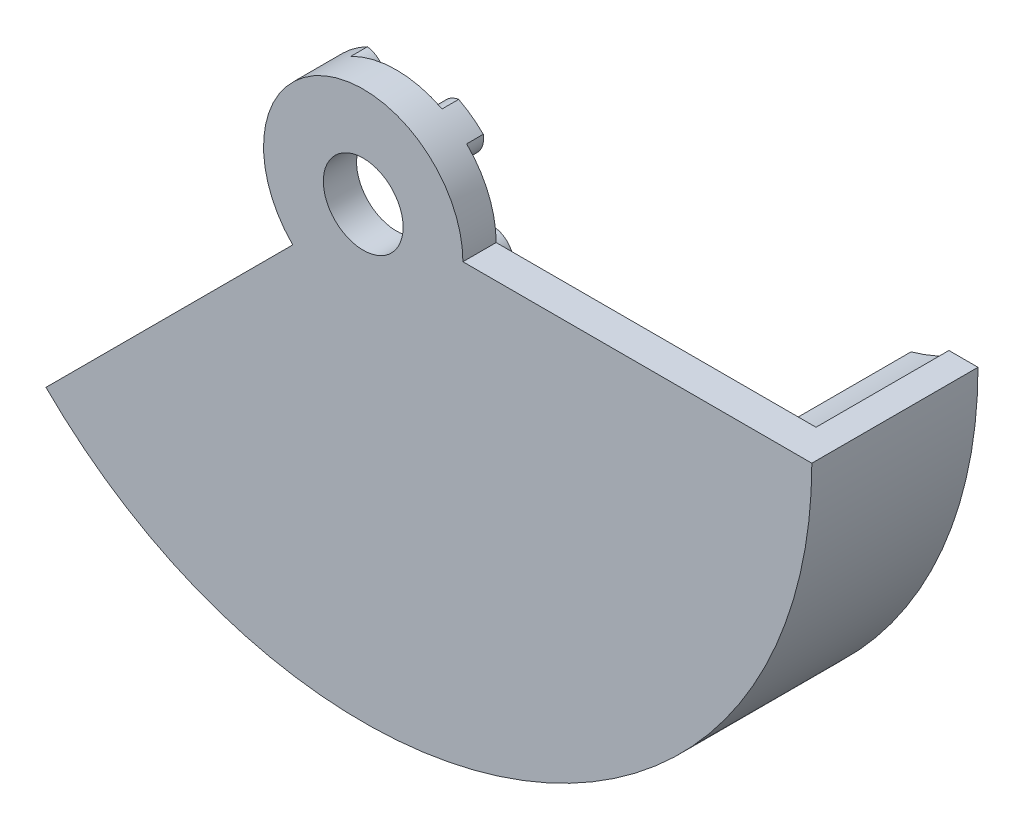
from build123d import *

# Parameters (mm, degrees)
SKETCH4_R           = 67.5
BOSS_EXTRUDE1_DEPTH = 50
CUT_EXTRUDE2_DEPTH  = 250
BOSS_EXTRUDE2_DEPTH = 5
SKETCH7_R           = 6
CUT_EXTRUDE3_DEPTH  = 5
SKETCH8_R           = 10
SKETCH8_R_2         = 6
BOSS_EXTRUDE3_DEPTH = 5
CUT_EXTRUDE5_DEPTH  = 30
BOSS_EXTRUDE4_START = -5
SKETCH11_R          = 15
SKETCH11_R_2        = 6
BOSS_EXTRUDE4_DEPTH = 5
BOSS_EXTRUDE5_DEPTH = 2.5


with BuildPart() as part:
    # Sketch4 → Boss-Extrude1 (new body)
    with BuildSketch(Plane.XY):
        Circle(SKETCH4_R)
        with BuildLine():
            ThreePointArc((11.932101608, 56.248332875), (11.217693516, 56.395153623), (10.501480633, 56.53290108))
            ThreePointArc((10.501480633, 56.53290108), (9.892570679, 59.547679882), (8.978186327, 62.484270391))
            ThreePointArc((8.978186327, 62.484270391), (8.23959641, 62.585948319), (7.49985715, 62.678896119))
            ThreePointArc((7.49985715, 62.678896119), (5.856584138, 60.079027591), (4.488140116, 57.324572378))
            ThreePointArc((4.488140116, 57.324572378), (3.760679931, 57.376888086), (3.032614698, 57.419972554))
            ThreePointArc((3.032614698, 57.419972554), (2.035406455, 60.329480808), (0.74554281, 63.12159727))
            ThreePointArc((0.74554281, 63.12159727), (0, 63.126), (-0.74554281, 63.12159727))
            ThreePointArc((-0.74554281, 63.12159727), (-2.035406455, 60.329480808), (-3.032614698, 57.419972554))
            ThreePointArc((-3.032614698, 57.419972554), (-3.760679931, 57.376888086), (-4.488140116, 57.324572378))
            ThreePointArc((-4.488140116, 57.324572378), (-5.856584138, 60.079027591), (-7.49985715, 62.678896119))
            ThreePointArc((-7.49985715, 62.678896119), (-8.23959641, 62.585948319), (-8.978186327, 62.484270391))
            ThreePointArc((-8.978186327, 62.484270391), (-9.892570679, 59.547679882), (-10.501480633, 56.53290108))
            ThreePointArc((-10.501480633, 56.53290108), (-11.217693516, 56.395153623), (-11.932101608, 56.248332875))
            ThreePointArc((-11.932101608, 56.248332875), (-13.648366952, 58.800605554), (-15.616932476, 61.163741678))
            ThreePointArc((-15.616932476, 61.163741678), (-16.338211041, 60.97503371), (-17.057210586, 60.777820322))
            ThreePointArc((-17.057210586, 60.777820322), (-17.580470276, 57.747001644), (-17.790663324, 54.678535994))
            ThreePointArc((-17.790663324, 54.678535994), (-18.482769255, 54.448482446), (-19.171901534, 54.209668802))
            ThreePointArc((-19.171901534, 54.209668802), (-21.206622424, 56.516088854), (-23.466797757, 58.602058659))
            ThreePointArc((-23.466797757, 58.602058659), (-24.157274351, 58.320819369), (-24.844381243, 58.031444896))
            ThreePointArc((-24.844381243, 58.031444896), (-24.967563153, 54.958256197), (-24.775442833, 51.888605998))
            ThreePointArc((-24.775442833, 51.888605998), (-25.431599688, 51.570182638), (-26.083664909, 51.243462265))
            ThreePointArc((-26.083664909, 51.243462265), (-28.402026707, 53.264566205), (-30.915139622, 55.037678168))
            ThreePointArc((-30.915139622, 55.037678168), (-31.563, 54.668719639), (-32.206457648, 54.292135358))
            ThreePointArc((-32.206457648, 54.292135358), (-31.927454101, 51.229159749), (-31.336307645, 48.210847567))
            ThreePointArc((-31.336307645, 48.210847567), (-31.945288399, 47.809502707), (-32.549129545, 47.400465882))
            ThreePointArc((-32.549129545, 47.400465882), (-35.111464438, 49.101672059), (-37.834514877, 50.531587745))
            ThreePointArc((-37.834514877, 50.531587745), (-38.428673968, 50.081222959), (-39.017472634, 49.623872332))
            ThreePointArc((-39.017472634, 49.623872332), (-38.341057458, 46.623518175), (-37.360999546, 43.708188168))
            ThreePointArc((-37.360999546, 43.708188168), (-37.912384368, 43.23078893), (-38.457669551, 42.746434386))
            ThreePointArc((-38.457669551, 42.746434386), (-41.220135278, 44.098634692), (-44.106531092, 45.160887846))
            ThreePointArc((-44.106531092, 45.160887846), (-44.636822669, 44.636822669), (-45.160887846, 44.106531092))
            ThreePointArc((-45.160887846, 44.106531092), (-44.098634692, 41.220135278), (-42.746434386, 38.457669551))
            ThreePointArc((-42.746434386, 38.457669551), (-43.23078893, 37.912384368), (-43.708188168, 37.360999546))
            ThreePointArc((-43.708188168, 37.360999546), (-46.623518175, 38.341057458), (-49.623872332, 39.017472634))
            ThreePointArc((-49.623872332, 39.017472634), (-50.081222959, 38.428673968), (-50.531587745, 37.834514877))
            ThreePointArc((-50.531587745, 37.834514877), (-49.101672059, 35.111464438), (-47.400465882, 32.549129545))
            ThreePointArc((-47.400465882, 32.549129545), (-47.809502707, 31.945288399), (-48.210847567, 31.336307645))
            ThreePointArc((-48.210847567, 31.336307645), (-51.229159749, 31.927454101), (-54.292135358, 32.206457648))
            ThreePointArc((-54.292135358, 32.206457648), (-54.668719639, 31.563), (-55.037678168, 30.915139622))
            ThreePointArc((-55.037678168, 30.915139622), (-53.264566205, 28.402026707), (-51.243462265, 26.083664909))
            ThreePointArc((-51.243462265, 26.083664909), (-51.570182638, 25.431599688), (-51.888605998, 24.775442833))
            ThreePointArc((-51.888605998, 24.775442833), (-54.958256197, 24.967563153), (-58.031444896, 24.844381243))
            ThreePointArc((-58.031444896, 24.844381243), (-58.320819369, 24.157274351), (-58.602058659, 23.466797757))
            ThreePointArc((-58.602058659, 23.466797757), (-56.516088854, 21.206622424), (-54.209668802, 19.171901534))
            ThreePointArc((-54.209668802, 19.171901534), (-54.448482446, 18.482769255), (-54.678535994, 17.790663324))
            ThreePointArc((-54.678535994, 17.790663324), (-57.747001644, 17.580470276), (-60.777820322, 17.057210586))
            ThreePointArc((-60.777820322, 17.057210586), (-60.97503371, 16.338211041), (-61.163741678, 15.616932476))
            ThreePointArc((-61.163741678, 15.616932476), (-58.800605554, 13.648366952), (-56.248332875, 11.932101608))
            ThreePointArc((-56.248332875, 11.932101608), (-56.395153623, 11.217693516), (-56.53290108, 10.501480633))
            ThreePointArc((-56.53290108, 10.501480633), (-59.547679882, 9.892570679), (-62.484270391, 8.978186327))
            ThreePointArc((-62.484270391, 8.978186327), (-62.585948319, 8.23959641), (-62.678896119, 7.49985715))
            ThreePointArc((-62.678896119, 7.49985715), (-60.079027591, 5.856584138), (-57.324572378, 4.488140116))
            ThreePointArc((-57.324572378, 4.488140116), (-57.376888086, 3.760679931), (-57.419972554, 3.032614698))
            ThreePointArc((-57.419972554, 3.032614698), (-60.329480808, 2.035406455), (-63.12159727, 0.74554281))
            ThreePointArc((-63.12159727, 0.74554281), (-63.126, 0), (-63.12159727, -0.74554281))
            ThreePointArc((-63.12159727, -0.74554281), (-60.329480808, -2.035406455), (-57.419972554, -3.032614698))
            ThreePointArc((-57.419972554, -3.032614698), (-57.376888086, -3.760679931), (-57.324572378, -4.488140116))
            ThreePointArc((-57.324572378, -4.488140116), (-60.079027591, -5.856584138), (-62.678896119, -7.49985715))
            ThreePointArc((-62.678896119, -7.49985715), (-62.585948319, -8.23959641), (-62.484270391, -8.978186327))
            ThreePointArc((-62.484270391, -8.978186327), (-59.547679882, -9.892570679), (-56.53290108, -10.501480633))
            ThreePointArc((-56.53290108, -10.501480633), (-56.395153623, -11.217693516), (-56.248332875, -11.932101608))
            ThreePointArc((-56.248332875, -11.932101608), (-58.800605554, -13.648366952), (-61.163741678, -15.616932476))
            ThreePointArc((-61.163741678, -15.616932476), (-60.97503371, -16.338211041), (-60.777820322, -17.057210586))
            ThreePointArc((-60.777820322, -17.057210586), (-57.747001644, -17.580470276), (-54.678535994, -17.790663324))
            ThreePointArc((-54.678535994, -17.790663324), (-54.448482446, -18.482769255), (-54.209668802, -19.171901534))
            ThreePointArc((-54.209668802, -19.171901534), (-56.516088854, -21.206622424), (-58.602058659, -23.466797757))
            ThreePointArc((-58.602058659, -23.466797757), (-58.320819369, -24.157274351), (-58.031444896, -24.844381243))
            ThreePointArc((-58.031444896, -24.844381243), (-54.958256197, -24.967563153), (-51.888605998, -24.775442833))
            ThreePointArc((-51.888605998, -24.775442833), (-51.570182638, -25.431599688), (-51.243462265, -26.083664909))
            ThreePointArc((-51.243462265, -26.083664909), (-53.264566205, -28.402026707), (-55.037678168, -30.915139622))
            ThreePointArc((-55.037678168, -30.915139622), (-54.668719639, -31.563), (-54.292135358, -32.206457648))
            ThreePointArc((-54.292135358, -32.206457648), (-51.229159749, -31.927454101), (-48.210847567, -31.336307645))
            ThreePointArc((-48.210847567, -31.336307645), (-47.809502707, -31.945288399), (-47.400465882, -32.549129545))
            ThreePointArc((-47.400465882, -32.549129545), (-49.101672059, -35.111464438), (-50.531587745, -37.834514877))
            ThreePointArc((-50.531587745, -37.834514877), (-50.081222959, -38.428673968), (-49.623872332, -39.017472634))
            ThreePointArc((-49.623872332, -39.017472634), (-46.623518175, -38.341057458), (-43.708188168, -37.360999546))
            ThreePointArc((-43.708188168, -37.360999546), (-43.23078893, -37.912384368), (-42.746434386, -38.457669551))
            ThreePointArc((-42.746434386, -38.457669551), (-44.098634692, -41.220135278), (-45.160887846, -44.106531092))
            ThreePointArc((-45.160887846, -44.106531092), (-44.636822669, -44.636822669), (-44.106531092, -45.160887846))
            ThreePointArc((-44.106531092, -45.160887846), (-41.220135278, -44.098634692), (-38.457669551, -42.746434386))
            ThreePointArc((-38.457669551, -42.746434386), (-37.912384368, -43.23078893), (-37.360999546, -43.708188168))
            ThreePointArc((-37.360999546, -43.708188168), (-38.341057458, -46.623518175), (-39.017472634, -49.623872332))
            ThreePointArc((-39.017472634, -49.623872332), (-38.428673968, -50.081222959), (-37.834514877, -50.531587745))
            ThreePointArc((-37.834514877, -50.531587745), (-35.111464438, -49.101672059), (-32.549129545, -47.400465882))
            ThreePointArc((-32.549129545, -47.400465882), (-31.945288399, -47.809502707), (-31.336307645, -48.210847567))
            ThreePointArc((-31.336307645, -48.210847567), (-31.927454101, -51.229159749), (-32.206457648, -54.292135358))
            ThreePointArc((-32.206457648, -54.292135358), (-31.563, -54.668719639), (-30.915139622, -55.037678168))
            ThreePointArc((-30.915139622, -55.037678168), (-28.402026707, -53.264566205), (-26.083664909, -51.243462265))
            ThreePointArc((-26.083664909, -51.243462265), (-25.431599688, -51.570182638), (-24.775442833, -51.888605998))
            ThreePointArc((-24.775442833, -51.888605998), (-24.967563153, -54.958256197), (-24.844381243, -58.031444896))
            ThreePointArc((-24.844381243, -58.031444896), (-24.157274351, -58.320819369), (-23.466797757, -58.602058659))
            ThreePointArc((-23.466797757, -58.602058659), (-21.206622424, -56.516088854), (-19.171901534, -54.209668802))
            ThreePointArc((-19.171901534, -54.209668802), (-18.482769255, -54.448482446), (-17.790663324, -54.678535994))
            ThreePointArc((-17.790663324, -54.678535994), (-17.580470276, -57.747001644), (-17.057210586, -60.777820322))
            ThreePointArc((-17.057210586, -60.777820322), (-16.338211041, -60.97503371), (-15.616932476, -61.163741678))
            ThreePointArc((-15.616932476, -61.163741678), (-13.648366952, -58.800605554), (-11.932101608, -56.248332875))
            ThreePointArc((-11.932101608, -56.248332875), (-11.217693516, -56.395153623), (-10.501480633, -56.53290108))
            ThreePointArc((-10.501480633, -56.53290108), (-9.892570679, -59.547679882), (-8.978186327, -62.484270391))
            ThreePointArc((-8.978186327, -62.484270391), (-8.23959641, -62.585948319), (-7.49985715, -62.678896119))
            ThreePointArc((-7.49985715, -62.678896119), (-5.856584138, -60.079027591), (-4.488140116, -57.324572378))
            ThreePointArc((-4.488140116, -57.324572378), (-3.760679931, -57.376888086), (-3.032614698, -57.419972554))
            ThreePointArc((-3.032614698, -57.419972554), (-2.035406455, -60.329480808), (-0.74554281, -63.12159727))
            ThreePointArc((-0.74554281, -63.12159727), (0, -63.126), (0.74554281, -63.12159727))
            ThreePointArc((0.74554281, -63.12159727), (2.035406455, -60.329480808), (3.032614698, -57.419972554))
            ThreePointArc((3.032614698, -57.419972554), (3.760679931, -57.376888086), (4.488140116, -57.324572378))
            ThreePointArc((4.488140116, -57.324572378), (5.856584138, -60.079027591), (7.49985715, -62.678896119))
            ThreePointArc((7.49985715, -62.678896119), (8.23959641, -62.585948319), (8.978186327, -62.484270391))
            ThreePointArc((8.978186327, -62.484270391), (9.892570679, -59.547679882), (10.501480633, -56.53290108))
            ThreePointArc((10.501480633, -56.53290108), (11.217693516, -56.395153623), (11.932101608, -56.248332875))
            ThreePointArc((11.932101608, -56.248332875), (13.648366952, -58.800605554), (15.616932476, -61.163741678))
            ThreePointArc((15.616932476, -61.163741678), (16.338211041, -60.97503371), (17.057210586, -60.777820322))
            ThreePointArc((17.057210586, -60.777820322), (17.580470276, -57.747001644), (17.790663324, -54.678535994))
            ThreePointArc((17.790663324, -54.678535994), (18.482769255, -54.448482446), (19.171901534, -54.209668802))
            ThreePointArc((19.171901534, -54.209668802), (21.206622424, -56.516088854), (23.466797757, -58.602058659))
            ThreePointArc((23.466797757, -58.602058659), (24.157274351, -58.320819369), (24.844381243, -58.031444896))
            ThreePointArc((24.844381243, -58.031444896), (24.967563153, -54.958256197), (24.775442833, -51.888605998))
            ThreePointArc((24.775442833, -51.888605998), (25.431599688, -51.570182638), (26.083664909, -51.243462265))
            ThreePointArc((26.083664909, -51.243462265), (28.402026707, -53.264566205), (30.915139622, -55.037678168))
            ThreePointArc((30.915139622, -55.037678168), (31.563, -54.668719639), (32.206457648, -54.292135358))
            ThreePointArc((32.206457648, -54.292135358), (31.927454101, -51.229159749), (31.336307645, -48.210847567))
            ThreePointArc((31.336307645, -48.210847567), (31.945288399, -47.809502707), (32.549129545, -47.400465882))
            ThreePointArc((32.549129545, -47.400465882), (35.111464438, -49.101672059), (37.834514877, -50.531587745))
            ThreePointArc((37.834514877, -50.531587745), (38.428673968, -50.081222959), (39.017472634, -49.623872332))
            ThreePointArc((39.017472634, -49.623872332), (38.341057458, -46.623518175), (37.360999546, -43.708188168))
            ThreePointArc((37.360999546, -43.708188168), (37.912384368, -43.23078893), (38.457669551, -42.746434386))
            ThreePointArc((38.457669551, -42.746434386), (41.220135278, -44.098634692), (44.106531092, -45.160887846))
            ThreePointArc((44.106531092, -45.160887846), (44.636822669, -44.636822669), (45.160887846, -44.106531092))
            ThreePointArc((45.160887846, -44.106531092), (44.098634692, -41.220135278), (42.746434386, -38.457669551))
            ThreePointArc((42.746434386, -38.457669551), (43.23078893, -37.912384368), (43.708188168, -37.360999546))
            ThreePointArc((43.708188168, -37.360999546), (46.623518175, -38.341057458), (49.623872332, -39.017472634))
            ThreePointArc((49.623872332, -39.017472634), (50.081222959, -38.428673968), (50.531587745, -37.834514877))
            ThreePointArc((50.531587745, -37.834514877), (49.101672059, -35.111464438), (47.400465882, -32.549129545))
            ThreePointArc((47.400465882, -32.549129545), (47.809502707, -31.945288399), (48.210847567, -31.336307645))
            ThreePointArc((48.210847567, -31.336307645), (51.229159749, -31.927454101), (54.292135358, -32.206457648))
            ThreePointArc((54.292135358, -32.206457648), (54.668719639, -31.563), (55.037678168, -30.915139622))
            ThreePointArc((55.037678168, -30.915139622), (53.264566205, -28.402026707), (51.243462265, -26.083664909))
            ThreePointArc((51.243462265, -26.083664909), (51.570182638, -25.431599688), (51.888605998, -24.775442833))
            ThreePointArc((51.888605998, -24.775442833), (54.958256197, -24.967563153), (58.031444896, -24.844381243))
            ThreePointArc((58.031444896, -24.844381243), (58.320819369, -24.157274351), (58.602058659, -23.466797757))
            ThreePointArc((58.602058659, -23.466797757), (56.516088854, -21.206622424), (54.209668802, -19.171901534))
            ThreePointArc((54.209668802, -19.171901534), (54.448482446, -18.482769255), (54.678535994, -17.790663324))
            ThreePointArc((54.678535994, -17.790663324), (57.747001644, -17.580470276), (60.777820322, -17.057210586))
            ThreePointArc((60.777820322, -17.057210586), (60.97503371, -16.338211041), (61.163741678, -15.616932476))
            ThreePointArc((61.163741678, -15.616932476), (58.800605554, -13.648366952), (56.248332875, -11.932101608))
            ThreePointArc((56.248332875, -11.932101608), (56.395153623, -11.217693516), (56.53290108, -10.501480633))
            ThreePointArc((56.53290108, -10.501480633), (59.547679882, -9.892570679), (62.484270391, -8.978186327))
            ThreePointArc((62.484270391, -8.978186327), (62.585948319, -8.23959641), (62.678896119, -7.49985715))
            ThreePointArc((62.678896119, -7.49985715), (60.079027591, -5.856584138), (57.324572378, -4.488140116))
            ThreePointArc((57.324572378, -4.488140116), (57.376888086, -3.760679931), (57.419972554, -3.032614698))
            ThreePointArc((57.419972554, -3.032614698), (60.329480808, -2.035406455), (63.12159727, -0.74554281))
            ThreePointArc((63.12159727, -0.74554281), (63.126, 0), (63.12159727, 0.74554281))
            ThreePointArc((63.12159727, 0.74554281), (60.329480808, 2.035406455), (57.419972554, 3.032614698))
            ThreePointArc((57.419972554, 3.032614698), (57.376888086, 3.760679931), (57.324572378, 4.488140116))
            ThreePointArc((57.324572378, 4.488140116), (60.079027591, 5.856584138), (62.678896119, 7.49985715))
            ThreePointArc((62.678896119, 7.49985715), (62.585948319, 8.23959641), (62.484270391, 8.978186327))
            ThreePointArc((62.484270391, 8.978186327), (59.547679882, 9.892570679), (56.53290108, 10.501480633))
            ThreePointArc((56.53290108, 10.501480633), (56.395153623, 11.217693516), (56.248332875, 11.932101608))
            ThreePointArc((56.248332875, 11.932101608), (58.800605554, 13.648366952), (61.163741678, 15.616932476))
            ThreePointArc((61.163741678, 15.616932476), (60.97503371, 16.338211041), (60.777820322, 17.057210586))
            ThreePointArc((60.777820322, 17.057210586), (57.747001644, 17.580470276), (54.678535994, 17.790663324))
            ThreePointArc((54.678535994, 17.790663324), (54.448482446, 18.482769255), (54.209668802, 19.171901534))
            ThreePointArc((54.209668802, 19.171901534), (56.516088854, 21.206622424), (58.602058659, 23.466797757))
            ThreePointArc((58.602058659, 23.466797757), (58.320819369, 24.157274351), (58.031444896, 24.844381243))
            ThreePointArc((58.031444896, 24.844381243), (54.958256197, 24.967563153), (51.888605998, 24.775442833))
            ThreePointArc((51.888605998, 24.775442833), (51.570182638, 25.431599688), (51.243462265, 26.083664909))
            ThreePointArc((51.243462265, 26.083664909), (53.264566205, 28.402026707), (55.037678168, 30.915139622))
            ThreePointArc((55.037678168, 30.915139622), (54.668719639, 31.563), (54.292135358, 32.206457648))
            ThreePointArc((54.292135358, 32.206457648), (51.229159749, 31.927454101), (48.210847567, 31.336307645))
            ThreePointArc((48.210847567, 31.336307645), (47.809502707, 31.945288399), (47.400465882, 32.549129545))
            ThreePointArc((47.400465882, 32.549129545), (49.101672059, 35.111464438), (50.531587745, 37.834514877))
            ThreePointArc((50.531587745, 37.834514877), (50.081222959, 38.428673968), (49.623872332, 39.017472634))
            ThreePointArc((49.623872332, 39.017472634), (46.623518175, 38.341057458), (43.708188168, 37.360999546))
            ThreePointArc((43.708188168, 37.360999546), (43.23078893, 37.912384368), (42.746434386, 38.457669551))
            ThreePointArc((42.746434386, 38.457669551), (44.098634692, 41.220135278), (45.160887846, 44.106531092))
            ThreePointArc((45.160887846, 44.106531092), (44.636822669, 44.636822669), (44.106531092, 45.160887846))
            ThreePointArc((44.106531092, 45.160887846), (41.220135278, 44.098634692), (38.457669551, 42.746434386))
            ThreePointArc((38.457669551, 42.746434386), (37.912384368, 43.23078893), (37.360999546, 43.708188168))
            ThreePointArc((37.360999546, 43.708188168), (38.341057458, 46.623518175), (39.017472634, 49.623872332))
            ThreePointArc((39.017472634, 49.623872332), (38.428673968, 50.081222959), (37.834514877, 50.531587745))
            ThreePointArc((37.834514877, 50.531587745), (35.111464438, 49.101672059), (32.549129545, 47.400465882))
            ThreePointArc((32.549129545, 47.400465882), (31.945288399, 47.809502707), (31.336307645, 48.210847567))
            ThreePointArc((31.336307645, 48.210847567), (31.927454101, 51.229159749), (32.206457648, 54.292135358))
            ThreePointArc((32.206457648, 54.292135358), (31.563, 54.668719639), (30.915139622, 55.037678168))
            ThreePointArc((30.915139622, 55.037678168), (28.402026707, 53.264566205), (26.083664909, 51.243462265))
            ThreePointArc((26.083664909, 51.243462265), (25.431599688, 51.570182638), (24.775442833, 51.888605998))
            ThreePointArc((24.775442833, 51.888605998), (24.967563153, 54.958256197), (24.844381243, 58.031444896))
            ThreePointArc((24.844381243, 58.031444896), (24.157274351, 58.320819369), (23.466797757, 58.602058659))
            ThreePointArc((23.466797757, 58.602058659), (21.206622424, 56.516088854), (19.171901534, 54.209668802))
            ThreePointArc((19.171901534, 54.209668802), (18.482769255, 54.448482446), (17.790663324, 54.678535994))
            ThreePointArc((17.790663324, 54.678535994), (17.580470276, 57.747001644), (17.057210586, 60.777820322))
            ThreePointArc((17.057210586, 60.777820322), (16.338211041, 60.97503371), (15.616932476, 61.163741678))
            ThreePointArc((15.616932476, 61.163741678), (13.648366952, 58.800605554), (11.932101608, 56.248332875))
        make_face(mode=Mode.SUBTRACT)
    extrude(amount=BOSS_EXTRUDE1_DEPTH)

    # Sketch5 → Cut-Extrude2 (cut)
    with BuildSketch(Plane(origin=(0, 0, 0), x_dir=(-1, 0, 0), z_dir=(0, 0, -1))):
        with BuildLine():
            Line((-67.5, 0), (0, 0))
            Line((0, 0), (47.72970773, -47.72970773))
            ThreePointArc((47.72970773, -47.72970773), (25.831131685, 62.361868445), (-67.5, 0))
        make_face()
    extrude(amount=-CUT_EXTRUDE2_DEPTH, mode=Mode.SUBTRACT)

    # Sketch6 → Boss-Extrude2 (add)
    with BuildSketch(Plane.XY.offset(50)):
        with BuildLine():
            Line((67.5, 0), (0, 0))
            Line((0, 0), (-47.72970773, -47.72970773))
            ThreePointArc((-47.72970773, -47.72970773), (25.831131685, -62.361868445), (67.5, 0))
        make_face()
    extrude(amount=BOSS_EXTRUDE2_DEPTH)

    # Sketch7 → Cut-Extrude3 (cut)
    with BuildSketch(Plane.XY.offset(55)):
        Circle(SKETCH7_R)
    extrude(amount=-CUT_EXTRUDE3_DEPTH, mode=Mode.SUBTRACT)

    # Sketch8 → Boss-Extrude3 (add)
    with BuildSketch(Plane.XY.offset(55)):
        Circle(SKETCH8_R)
        Circle(SKETCH8_R_2, mode=Mode.SUBTRACT)
    extrude(amount=-BOSS_EXTRUDE3_DEPTH)

    # Sketch9 → Cut-Extrude5 (cut)
    with BuildSketch(Plane(origin=(0, 0, 0), x_dir=(-1, 0, 0), z_dir=(0, 0, -1))):
        with BuildLine():
            Line((47.72970773, -47.72970773), (44.636822669, -44.636822669))
            ThreePointArc((44.636822669, -44.636822669), (44.372450578, -44.899638147), (44.106531092, -45.160887846))
            ThreePointArc((44.106531092, -45.160887846), (41.220135278, -44.098634692), (38.457669551, -42.746434386))
            ThreePointArc((38.457669551, -42.746434386), (37.912384368, -43.23078893), (37.360999546, -43.708188168))
            ThreePointArc((37.360999546, -43.708188168), (38.341057458, -46.623518175), (39.017472634, -49.623872332))
            ThreePointArc((39.017472634, -49.623872332), (38.428673968, -50.081222959), (37.834514877, -50.531587745))
            ThreePointArc((37.834514877, -50.531587745), (35.111464438, -49.101672059), (32.549129545, -47.400465882))
            ThreePointArc((32.549129545, -47.400465882), (31.945288399, -47.809502707), (31.336307645, -48.210847567))
            ThreePointArc((31.336307645, -48.210847567), (31.927454101, -51.229159749), (32.206457648, -54.292135358))
            ThreePointArc((32.206457648, -54.292135358), (31.563, -54.668719639), (30.915139622, -55.037678168))
            ThreePointArc((30.915139622, -55.037678168), (28.402026707, -53.264566205), (26.083664909, -51.243462265))
            ThreePointArc((26.083664909, -51.243462265), (25.431599688, -51.570182638), (24.775442833, -51.888605998))
            ThreePointArc((24.775442833, -51.888605998), (24.967563153, -54.958256197), (24.844381243, -58.031444896))
            ThreePointArc((24.844381243, -58.031444896), (24.157274351, -58.320819369), (23.466797757, -58.602058659))
            ThreePointArc((23.466797757, -58.602058659), (21.206622424, -56.516088854), (19.171901534, -54.209668802))
            ThreePointArc((19.171901534, -54.209668802), (18.482769255, -54.448482446), (17.790663324, -54.678535994))
            ThreePointArc((17.790663324, -54.678535994), (17.580470276, -57.747001644), (17.057210586, -60.777820322))
            ThreePointArc((17.057210586, -60.777820322), (16.338211041, -60.97503371), (15.616932476, -61.163741678))
            ThreePointArc((15.616932476, -61.163741678), (13.648366952, -58.800605554), (11.932101608, -56.248332875))
            ThreePointArc((11.932101608, -56.248332875), (11.217693516, -56.395153623), (10.501480633, -56.53290108))
            ThreePointArc((10.501480633, -56.53290108), (9.892570679, -59.547679882), (8.978186327, -62.484270391))
            ThreePointArc((8.978186327, -62.484270391), (8.23959641, -62.585948319), (7.49985715, -62.678896119))
            ThreePointArc((7.49985715, -62.678896119), (5.856584138, -60.079027591), (4.488140116, -57.324572378))
            ThreePointArc((4.488140116, -57.324572378), (3.760679931, -57.376888086), (3.032614698, -57.419972554))
            ThreePointArc((3.032614698, -57.419972554), (2.035406455, -60.329480808), (0.74554281, -63.12159727))
            ThreePointArc((0.74554281, -63.12159727), (0, -63.126), (-0.74554281, -63.12159727))
            ThreePointArc((-0.74554281, -63.12159727), (-2.035406455, -60.329480808), (-3.032614698, -57.419972554))
            ThreePointArc((-3.032614698, -57.419972554), (-3.760679931, -57.376888086), (-4.488140116, -57.324572378))
            ThreePointArc((-4.488140116, -57.324572378), (-5.856584138, -60.079027591), (-7.49985715, -62.678896119))
            ThreePointArc((-7.49985715, -62.678896119), (-8.23959641, -62.585948319), (-8.978186327, -62.484270391))
            ThreePointArc((-8.978186327, -62.484270391), (-9.892570679, -59.547679882), (-10.501480633, -56.53290108))
            ThreePointArc((-10.501480633, -56.53290108), (-11.217693516, -56.395153623), (-11.932101608, -56.248332875))
            ThreePointArc((-11.932101608, -56.248332875), (-13.648366952, -58.800605554), (-15.616932476, -61.163741678))
            ThreePointArc((-15.616932476, -61.163741678), (-16.338211041, -60.97503371), (-17.057210586, -60.777820322))
            ThreePointArc((-17.057210586, -60.777820322), (-17.580470276, -57.747001644), (-17.790663324, -54.678535994))
            ThreePointArc((-17.790663324, -54.678535994), (-18.482769255, -54.448482446), (-19.171901534, -54.209668802))
            ThreePointArc((-19.171901534, -54.209668802), (-21.206622424, -56.516088854), (-23.466797757, -58.602058659))
            ThreePointArc((-23.466797757, -58.602058659), (-24.157274351, -58.320819369), (-24.844381243, -58.031444896))
            ThreePointArc((-24.844381243, -58.031444896), (-24.967563153, -54.958256197), (-24.775442833, -51.888605998))
            ThreePointArc((-24.775442833, -51.888605998), (-25.431599688, -51.570182638), (-26.083664909, -51.243462265))
            ThreePointArc((-26.083664909, -51.243462265), (-28.402026707, -53.264566205), (-30.915139622, -55.037678168))
            ThreePointArc((-30.915139622, -55.037678168), (-31.563, -54.668719639), (-32.206457648, -54.292135358))
            ThreePointArc((-32.206457648, -54.292135358), (-31.927454101, -51.229159749), (-31.336307645, -48.210847567))
            ThreePointArc((-31.336307645, -48.210847567), (-31.945288399, -47.809502707), (-32.549129545, -47.400465882))
            ThreePointArc((-32.549129545, -47.400465882), (-35.111464438, -49.101672059), (-37.834514877, -50.531587745))
            ThreePointArc((-37.834514877, -50.531587745), (-38.428673968, -50.081222959), (-39.017472634, -49.623872332))
            ThreePointArc((-39.017472634, -49.623872332), (-38.341057458, -46.623518175), (-37.360999546, -43.708188168))
            ThreePointArc((-37.360999546, -43.708188168), (-37.912384368, -43.23078893), (-38.457669551, -42.746434386))
            ThreePointArc((-38.457669551, -42.746434386), (-41.220135278, -44.098634692), (-44.106531092, -45.160887846))
            ThreePointArc((-44.106531092, -45.160887846), (-44.636822669, -44.636822669), (-45.160887846, -44.106531092))
            ThreePointArc((-45.160887846, -44.106531092), (-44.098634692, -41.220135278), (-42.746434386, -38.457669551))
            ThreePointArc((-42.746434386, -38.457669551), (-43.23078893, -37.912384368), (-43.708188168, -37.360999546))
            ThreePointArc((-43.708188168, -37.360999546), (-46.623518175, -38.341057458), (-49.623872332, -39.017472634))
            ThreePointArc((-49.623872332, -39.017472634), (-50.081222959, -38.428673968), (-50.531587745, -37.834514877))
            ThreePointArc((-50.531587745, -37.834514877), (-49.101672059, -35.111464438), (-47.400465882, -32.549129545))
            ThreePointArc((-47.400465882, -32.549129545), (-47.809502707, -31.945288399), (-48.210847567, -31.336307645))
            ThreePointArc((-48.210847567, -31.336307645), (-51.229159749, -31.927454101), (-54.292135358, -32.206457648))
            ThreePointArc((-54.292135358, -32.206457648), (-54.668719639, -31.563), (-55.037678168, -30.915139622))
            ThreePointArc((-55.037678168, -30.915139622), (-53.264566205, -28.402026707), (-51.243462265, -26.083664909))
            ThreePointArc((-51.243462265, -26.083664909), (-51.570182638, -25.431599688), (-51.888605998, -24.775442833))
            ThreePointArc((-51.888605998, -24.775442833), (-54.958256197, -24.967563153), (-58.031444896, -24.844381243))
            ThreePointArc((-58.031444896, -24.844381243), (-58.320819369, -24.157274351), (-58.602058659, -23.466797757))
            ThreePointArc((-58.602058659, -23.466797757), (-56.516088854, -21.206622424), (-54.209668802, -19.171901534))
            ThreePointArc((-54.209668802, -19.171901534), (-54.448482446, -18.482769255), (-54.678535994, -17.790663324))
            ThreePointArc((-54.678535994, -17.790663324), (-57.747001644, -17.580470276), (-60.777820322, -17.057210586))
            ThreePointArc((-60.777820322, -17.057210586), (-60.97503371, -16.338211041), (-61.163741678, -15.616932476))
            ThreePointArc((-61.163741678, -15.616932476), (-58.800605554, -13.648366952), (-56.248332875, -11.932101608))
            ThreePointArc((-56.248332875, -11.932101608), (-56.395153623, -11.217693516), (-56.53290108, -10.501480633))
            ThreePointArc((-56.53290108, -10.501480633), (-59.547679882, -9.892570679), (-62.484270391, -8.978186327))
            ThreePointArc((-62.484270391, -8.978186327), (-62.585948319, -8.23959641), (-62.678896119, -7.49985715))
            ThreePointArc((-62.678896119, -7.49985715), (-60.079027591, -5.856584138), (-57.324572378, -4.488140116))
            ThreePointArc((-57.324572378, -4.488140116), (-57.376888086, -3.760679931), (-57.419972554, -3.032614698))
            ThreePointArc((-57.419972554, -3.032614698), (-60.329480808, -2.035406455), (-63.12159727, -0.74554281))
            ThreePointArc((-63.12159727, -0.74554281), (-63.124899308, -0.372777905), (-63.126, 0))
            Line((-63.126, 0), (-67.5, 0))
            ThreePointArc((-67.5, 0), (-25.831131685, -62.361868445), (47.72970773, -47.72970773))
        make_face()
    extrude(amount=-CUT_EXTRUDE5_DEPTH, mode=Mode.SUBTRACT)

    # Sketch11 → Boss-Extrude4 (add)
    with BuildSketch(Plane(origin=(0, 0, 50), x_dir=(-1, 0, 0), z_dir=(0, 0, -1)).offset(BOSS_EXTRUDE4_START)):
        Circle(SKETCH11_R)
        Circle(SKETCH11_R_2, mode=Mode.SUBTRACT)
    extrude(amount=BOSS_EXTRUDE4_DEPTH)

    # Sketch10 → Boss-Extrude5 (add)
    with BuildSketch(Plane(origin=(0, 0, 50), x_dir=(-1, 0, 0), z_dir=(0, 0, -1))):
        with BuildLine():
            ThreePointArc((-2.290603582, -14.824072829), (0, -15), (2.290603582, -14.824072829))
            ThreePointArc((2.290603582, -14.824072829), (3.251534536, -12.224859227), (1.867509855, -9.824072829))
            ThreePointArc((1.867509855, -9.824072829), (0, -10), (-1.867509855, -9.824072829))
            ThreePointArc((-1.867509855, -9.824072829), (-3.251534536, -12.224859227), (-2.290603582, -14.824072829))
        make_face()
        with BuildLine():
            ThreePointArc((8.766156198, -4.811912875), (10.621752599, -6.870082363), (13.390695627, -6.759383893))
            ThreePointArc((13.390695627, -6.759383893), (14.265847744, -4.635254916), (14.806366496, -2.402396967))
            ThreePointArc((14.806366496, -2.402396967), (12.631311458, -0.685296146), (9.920340763, -1.259698041))
            ThreePointArc((9.920340763, -1.259698041), (9.510565163, -3.090169944), (8.766156198, -4.811912875))
        make_face()
        with BuildLine():
            ThreePointArc((-14.806366496, -2.402396967), (-14.265847744, -4.635254916), (-13.390695627, -6.759383893))
            ThreePointArc((-13.390695627, -6.759383893), (-10.621752599, -6.870082363), (-8.766156198, -4.811912875))
            ThreePointArc((-8.766156198, -4.811912875), (-9.510565163, -3.090169944), (-9.920340763, -1.259698041))
            ThreePointArc((-9.920340763, -1.259698041), (-12.631311458, -0.685296146), (-14.806366496, -2.402396967))
        make_face()
        with BuildLine():
            ThreePointArc((7.285292336, 6.850147121), (9.816138662, 7.97891482), (10.566508613, 10.64654384))
            ThreePointArc((10.566508613, 10.64654384), (8.816778784, 12.135254916), (6.860234162, 13.339309849))
            ThreePointArc((6.860234162, 13.339309849), (4.555045267, 11.801322916), (4.263597916, 9.045536624))
            ThreePointArc((4.263597916, 9.045536624), (5.877852523, 8.090169944), (7.285292336, 6.850147121))
        make_face()
        with BuildLine():
            ThreePointArc((-6.860234162, 13.339309849), (-8.816778784, 12.135254916), (-10.566508613, 10.64654384))
            ThreePointArc((-10.566508613, 10.64654384), (-9.816138662, 7.97891482), (-7.285292336, 6.850147121))
            ThreePointArc((-7.285292336, 6.850147121), (-5.877852523, 8.090169944), (-4.263597916, 9.045536624))
            ThreePointArc((-4.263597916, 9.045536624), (-4.555045267, 11.801322916), (-6.860234162, 13.339309849))
        make_face()
    extrude(amount=BOSS_EXTRUDE5_DEPTH)


solid = part.part
